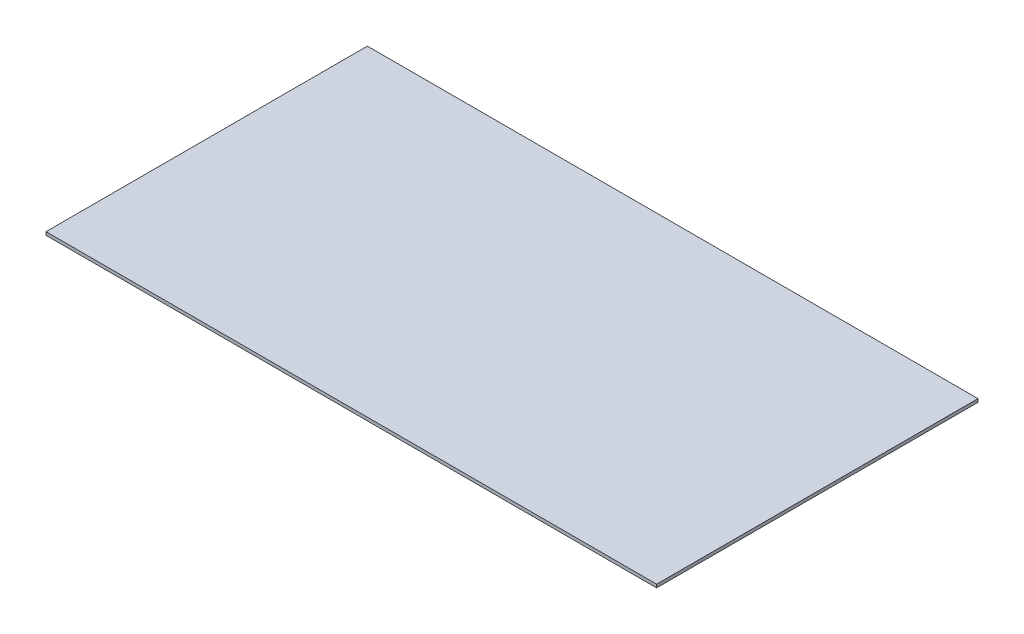
from build123d import *

# Parameters (mm, degrees)
SKETCH1_W          = 380
SKETCH1_H          = 200
BASE_FLANGE1_DEPTH = 2


# Sheet-metal steps are written as plain solids
with BuildPart() as part:
    # Sketch1 → Base-Flange1 (new body)
    with BuildSketch(Plane(origin=(0, 0, 0), x_dir=(1, 0, 0), z_dir=(0, 1, 0))):
        Rectangle(SKETCH1_W, SKETCH1_H)
    extrude(amount=BASE_FLANGE1_DEPTH)


solid = part.part
